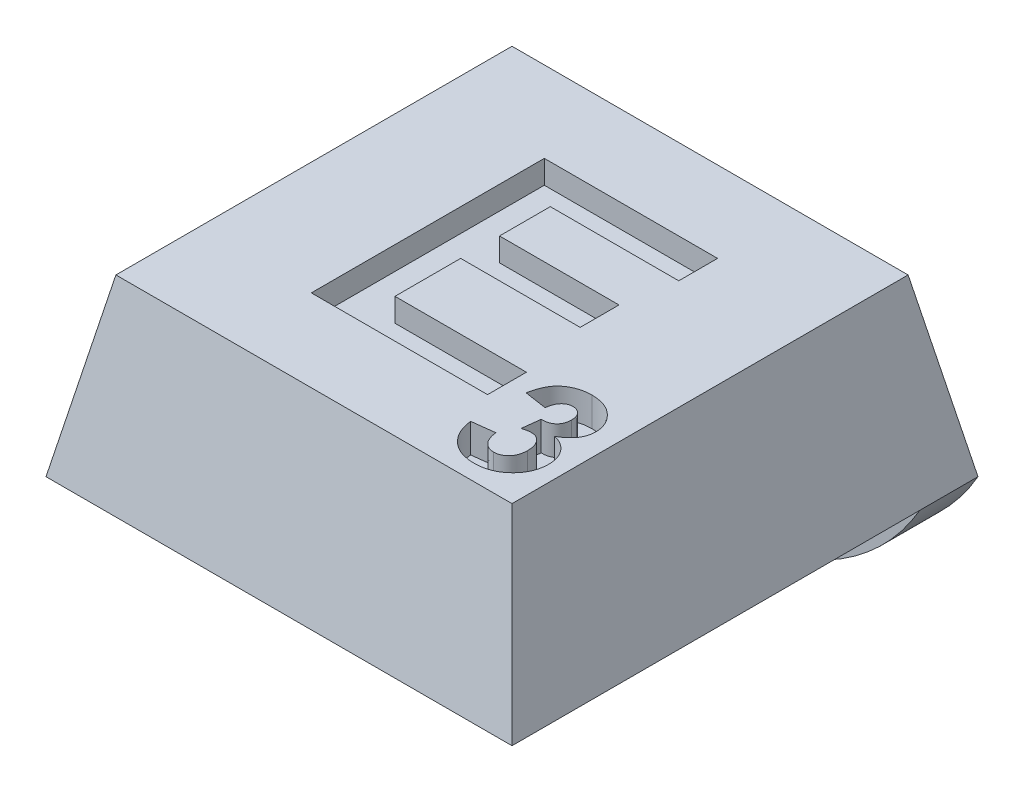
from build123d import *

# Parameters (mm, degrees)
SKETCH1_W               = 8
SKETCH1_H               = 8
BOSS_EXTRUDE1_DEPTH     = 3
CUT_EXTRUDE1_DEPTH      = 12.704699911
CUT_EXTRUDE1_DEPTH_BACK = 12.704699911
CUT_EXTRUDE2_DEPTH      = 11
SKETCH4_R               = 1.75
CUT_EXTRUDE3_DEPTH      = 0.4
SKETCH5_W               = 8
SKETCH5_H               = 1
BOSS_EXTRUDE2_DEPTH     = 2
FILLET1_R               = 4
CUT_EXTRUDE4_DEPTH      = 0.4
CUT_EXTRUDE5_DEPTH      = 0.5


with BuildPart() as part:
    # Sketch1 → Boss-Extrude1 (new body)
    with BuildSketch(Plane(origin=(0, 0, 0), x_dir=(1, 0, 0), z_dir=(0, 1, 0))):
        with Locations((4, 4)):
            Rectangle(SKETCH1_W, SKETCH1_H)
    extrude(amount=BOSS_EXTRUDE1_DEPTH)

    # Sketch2 → Cut-Extrude1 (cut, two sides: drawn at the far end of the back side and taken through both)
    with BuildSketch(Plane.XY.offset(-CUT_EXTRUDE1_DEPTH_BACK)):
        Polygon((0, 0), (0.6, 3), (0, 3), align=None)
        Polygon((8, 0), (7.4, 3), (8, 3), align=None)
    extrude(amount=CUT_EXTRUDE1_DEPTH + CUT_EXTRUDE1_DEPTH_BACK, mode=Mode.SUBTRACT)

    # Sketch3 → Cut-Extrude2 (cut)
    with BuildSketch(Plane(origin=(0, 0, 0), x_dir=(0, 0, -1), z_dir=(1, 0, 0))):
        Polygon((0, 0), (0.6, 3), (0, 3), align=None)
        Polygon((8, 3), (7.4, 3), (8, 0), align=None)
    extrude(amount=CUT_EXTRUDE2_DEPTH, mode=Mode.SUBTRACT)

    # Sketch4 → Cut-Extrude3 (cut)
    with BuildSketch(Plane.XZ):
        with Locations(Location((4, -3.75, 0), (0, 0, 270))):
            Circle(SKETCH4_R)
    extrude(amount=-CUT_EXTRUDE3_DEPTH, mode=Mode.SUBTRACT)

    # Sketch5 → Boss-Extrude2 (add)
    with BuildSketch(Plane.XZ):
        with Locations((4, -7.5)):
            Rectangle(SKETCH5_W, SKETCH5_H)
    extrude(amount=BOSS_EXTRUDE2_DEPTH)

    # Fillet1
    # the kernel refuses this fillet: 4 mm, written as the material it takes off along each edge
    with BuildSketch(Plane(origin=(8, -2, -16.660254038), x_dir=(0, 1, 0), z_dir=(0, 0, 1)), Plane(origin=(0, -2, 1.660254038), x_dir=(0, 1, 0), z_dir=(0, 0, -1))) as fillet1_piece_1:
        with BuildLine():
            CenterArc((4, 3.464101615), FILLET1_R, 180, 60)
            Line((0, 3.464101615), (-0.08, 3.464101615))
            Line((-0.08, 3.464101615), (-0.08, 0))
            Line((-0.08, 0), (0, -0.08))
            ThreePointArc((0, -0.08), (1, -0.08), (1.96, -0.069282032))
            Line((1.96, -0.069282032), (2, 0))
        make_face()
    extrude(amount=18.320508076, mode=Mode.SUBTRACT)

    # Sketch6 → Cut-Extrude4 (cut)
    with BuildSketch(Plane(origin=(0, 3, 0), x_dir=(1, 0, 0), z_dir=(0, 1, 0))):
        Polygon((2.544225106, 2.010567225), (2.544225106, 6.010567225), (5.51858408, 6.010567225), (5.51858408, 5.343900558), (3.313455875, 5.343900558), (3.313455875, 4.472105686), (5.364737926, 4.472105686), (5.364737926, 3.80543902), (3.313455875, 3.80543902), (3.313455875, 2.677233891), (5.569866131, 2.677233891), (5.569866131, 2.010567225), align=None)
    extrude(amount=-CUT_EXTRUDE4_DEPTH, mode=Mode.SUBTRACT)

    # Sketch7 → Cut-Extrude5 (cut)
    with BuildSketch(Plane(origin=(0, 3, 0), x_dir=(1, 0, 0), z_dir=(0, 1, 0))):
        with BuildLine():
            Line((5.822088817, 1.468310464), (6.206704202, 1.515586105))
            add(Edge.make_bspline(
                [(6.206704202, 1.515586105), (6.210025755, 1.491936921), (6.21633053, 1.447047438), (6.235989072, 1.384914698), (6.261652315, 1.330845836), (6.295629161, 1.286544364), (6.334912115, 1.251310519), (6.37872169, 1.226169889), (6.426661607, 1.210315729), (6.460052531, 1.208713548), (6.477136894, 1.207893797)],
                knots=[0, 0, 0, 0, 1.26631894, 2.403651751, 3.447242243, 4.428907923, 5.348362865, 6.231623936, 7.095215805, 8, 8, 8, 8], degree=3))
            add(Edge.make_bspline(
                [(6.477136894, 1.207893797), (6.486366298, 1.208091994), (6.504648304, 1.20848459), (6.531523321, 1.212603697), (6.557345996, 1.219374529), (6.58186155, 1.229117251), (6.605187017, 1.241222715), (6.627629553, 1.255638676), (6.648246393, 1.273643613), (6.668375088, 1.29334292), (6.68623752, 1.315767324), (6.701972196, 1.340096861), (6.715784117, 1.366090219), (6.726489771, 1.394417604), (6.734869896, 1.424465406), (6.740860884, 1.456364057), (6.744506994, 1.489993317), (6.74494315, 1.513039367), (6.74516574, 1.524800849)],
                knots=[0, 0, 0, 0, 0.951760839, 1.885289532, 2.797832748, 3.70117291, 4.60103766, 5.506897018, 6.445598779, 7.420035506, 8.410036365, 9.396193293, 10.407074535, 11.440988179, 12.514285005, 13.622404236, 14.786601276, 16, 16, 16, 16], degree=3))
            add(Edge.make_bspline(
                [(6.74516574, 1.524800849), (6.744331981, 1.546629456), (6.742741494, 1.588269906), (6.730451294, 1.647346431), (6.709137892, 1.699277092), (6.679276772, 1.743130281), (6.643793264, 1.778406879), (6.604044422, 1.8049236), (6.559654571, 1.820157256), (6.528795478, 1.822230353), (6.513194586, 1.823278413)],
                knots=[0, 0, 0, 0, 1.241512862, 2.368321189, 3.414110003, 4.41529485, 5.36642979, 6.245396713, 7.112955941, 8, 8, 8, 8], degree=3))
            add(Edge.make_bspline(
                [(6.513194586, 1.823278413), (6.502087722, 1.822994208), (6.47854234, 1.822391724), (6.441918774, 1.81613185), (6.401980616, 1.80749294), (6.374785766, 1.799182881), (6.360550356, 1.7948329)],
                knots=[0, 0, 0, 0, 0.854525515, 1.811503923, 2.854410343, 4, 4, 4, 4], degree=3))
            Line((6.360550356, 1.7948329), (6.396608048, 2.105329695))
            add(Edge.make_bspline(
                [(6.396608048, 2.105329695), (6.407296254, 2.105146348), (6.428036665, 2.104790564), (6.458323888, 2.107301653), (6.486673662, 2.111886341), (6.513019839, 2.119324972), (6.53738695, 2.128349551), (6.559988104, 2.139688262), (6.580270378, 2.153798702), (6.604965361, 2.175098338), (6.630230561, 2.207014566), (6.6530719, 2.250778884), (6.665798637, 2.300679459), (6.667408863, 2.335629458), (6.668242663, 2.353727131)],
                knots=[0, 0, 0, 0, 0.916749589, 1.778948191, 2.604102396, 3.376994206, 4.124053722, 4.831292757, 5.54010828, 6.238660037, 7.62386988, 9.002523041, 10.447858069, 12, 12, 12, 12], degree=3))
            add(Edge.make_bspline(
                [(6.668242663, 2.353727131), (6.667680515, 2.36913782), (6.666602635, 2.398686702), (6.656933325, 2.440733393), (6.640429824, 2.477855418), (6.617345194, 2.50940841), (6.589028098, 2.535030406), (6.555929861, 2.553963194), (6.518019093, 2.565003531), (6.491366313, 2.566231188), (6.477537535, 2.566868156)],
                knots=[0, 0, 0, 0, 1.146968804, 2.199229744, 3.192297141, 4.153502289, 5.090509175, 6.0173182, 6.971286811, 8, 8, 8, 8], degree=3))
            add(Edge.make_bspline(
                [(6.477537535, 2.566868156), (6.463673911, 2.566182836), (6.436422829, 2.564835732), (6.397428508, 2.551510744), (6.361454157, 2.530893795), (6.329709376, 2.501368407), (6.302195486, 2.464646404), (6.280874208, 2.419861118), (6.265858745, 2.367714197), (6.260698213, 2.33018187), (6.257986253, 2.3104579)],
                knots=[0, 0, 0, 0, 0.889956214, 1.749345552, 2.62404616, 3.543272128, 4.520224035, 5.562553653, 6.719074424, 8, 8, 8, 8], degree=3))
            Line((6.257986253, 2.3104579), (5.873370869, 2.368150208))
            add(Edge.make_bspline(
                [(5.873370869, 2.368150208), (5.879712758, 2.397514751), (5.891852554, 2.453725064), (5.916656, 2.532479948), (5.945759151, 2.602002338), (5.979761878, 2.663071325), (6.020038823, 2.716762155), (6.067859884, 2.763365742), (6.122509575, 2.804234412), (6.183883545, 2.838478774), (6.250614825, 2.865925856), (6.321633047, 2.886240153), (6.396757082, 2.897882068), (6.448117417, 2.899417689), (6.474332407, 2.90020149)],
                knots=[0, 0, 0, 0, 1.220808349, 2.336900656, 3.3513467, 4.279992853, 5.171472476, 6.069835959, 6.985198729, 7.938095762, 8.919113729, 9.91246339, 10.934493858, 12, 12, 12, 12], degree=3))
            add(Edge.make_bspline(
                [(6.474332407, 2.90020149), (6.496795991, 2.899690329), (6.540685792, 2.898691614), (6.604687523, 2.890097866), (6.665244055, 2.876137228), (6.722439804, 2.856388937), (6.776539911, 2.831244798), (6.826641223, 2.799609265), (6.873794781, 2.763093379), (6.901724377, 2.73467508), (6.915838817, 2.720313669)],
                knots=[0, 0, 0, 0, 1.096978699, 2.143298912, 3.148181587, 4.128190255, 5.094201205, 6.055441919, 7.017302331, 8, 8, 8, 8], degree=3))
            add(Edge.make_bspline(
                [(6.915838817, 2.720313669), (6.926741328, 2.708075606), (6.948274918, 2.683904162), (6.976233385, 2.645150995), (6.999633117, 2.604882958), (7.019482141, 2.563940258), (7.034243104, 2.52137348), (7.04524752, 2.477850813), (7.051783755, 2.43298662), (7.05249893, 2.402626167), (7.052858048, 2.387380977)],
                knots=[0, 0, 0, 0, 1.065582675, 2.104636323, 3.101288825, 4.092056841, 5.059084899, 6.026073946, 7.008813224, 8, 8, 8, 8], degree=3))
            add(Edge.make_bspline(
                [(7.052858048, 2.387380977), (7.052074688, 2.365937591), (7.050530541, 2.323668734), (7.036361111, 2.262180096), (7.013586987, 2.204054017), (6.982096895, 2.149068456), (6.941041129, 2.097733658), (6.890499978, 2.050511525), (6.831958555, 2.005600039), (6.787958464, 1.980231405), (6.765197792, 1.967108541)],
                knots=[0, 0, 0, 0, 0.957571776, 1.887550067, 2.804499428, 3.740591036, 4.709432777, 5.731457079, 6.826512349, 8, 8, 8, 8], degree=3))
            add(Edge.make_bspline(
                [(6.765197792, 1.967108541), (6.778741549, 1.963844189), (6.805468134, 1.957402478), (6.844077906, 1.94426987), (6.880236126, 1.927424278), (6.914828375, 1.908914943), (6.946996208, 1.886966635), (6.977363151, 1.862646466), (7.00476785, 1.834549826), (7.03102769, 1.804865641), (7.053982146, 1.772288453), (7.074722978, 1.738388398), (7.091382436, 1.702338355), (7.105631297, 1.665065232), (7.116248441, 1.625966572), (7.124562393, 1.585334894), (7.128729622, 1.542917296), (7.129427921, 1.514124194), (7.129781125, 1.499560464)],
                knots=[0, 0, 0, 0, 1.037381978, 2.047118658, 3.030848314, 4.005687143, 4.965748246, 5.927353932, 6.897971669, 7.885165084, 8.876109723, 9.862099733, 10.840989857, 11.829385213, 12.830906716, 13.855042526, 14.915067134, 16, 16, 16, 16], degree=3))
            add(Edge.make_bspline(
                [(7.129781125, 1.499560464), (7.129332308, 1.478289376), (7.12844718, 1.43633993), (7.11872513, 1.374773186), (7.10395436, 1.3156035), (7.083598929, 1.25859183), (7.056376257, 1.204435717), (7.023823759, 1.152375398), (6.985054773, 1.102929453), (6.940845684, 1.056472589), (6.892539484, 1.013951446), (6.84063463, 0.97660242), (6.785900139, 0.944991177), (6.728022396, 0.9191431), (6.667504686, 0.899031537), (6.603826037, 0.885208987), (6.537502989, 0.875987213), (6.49212598, 0.875040406), (6.469124074, 0.874560464)],
                knots=[0, 0, 0, 0, 1.006520189, 1.984993146, 2.943645202, 3.891894145, 4.845023195, 5.808336607, 6.795092628, 7.815033679, 8.841288157, 9.838185905, 10.83832808, 11.829129029, 12.835072876, 13.85234392, 14.911338897, 16, 16, 16, 16], degree=3))
            add(Edge.make_bspline(
                [(6.469124074, 0.874560464), (6.447326457, 0.874925903), (6.404510806, 0.875643711), (6.341832261, 0.884147308), (6.281800208, 0.896657101), (6.224765045, 0.914957582), (6.170229951, 0.937498647), (6.119224255, 0.966556317), (6.070434994, 0.999582769), (6.02545616, 1.03827062), (5.983635573, 1.080436419), (5.946901196, 1.126807021), (5.914165969, 1.175902437), (5.886010541, 1.228157933), (5.862670856, 1.283709297), (5.844497682, 1.342413141), (5.830004226, 1.404089696), (5.824763645, 1.446608551), (5.822088817, 1.468310464)],
                knots=[0, 0, 0, 0, 1.077528213, 2.11651914, 3.123276654, 4.10732375, 5.075386463, 6.036572488, 7.005896639, 7.98540975, 8.966414275, 9.939311093, 10.906719916, 11.882103104, 12.870994428, 13.882228509, 14.919075059, 16, 16, 16, 16], degree=3))
        make_face()
    extrude(amount=-CUT_EXTRUDE5_DEPTH, mode=Mode.SUBTRACT)


solid = part.part
